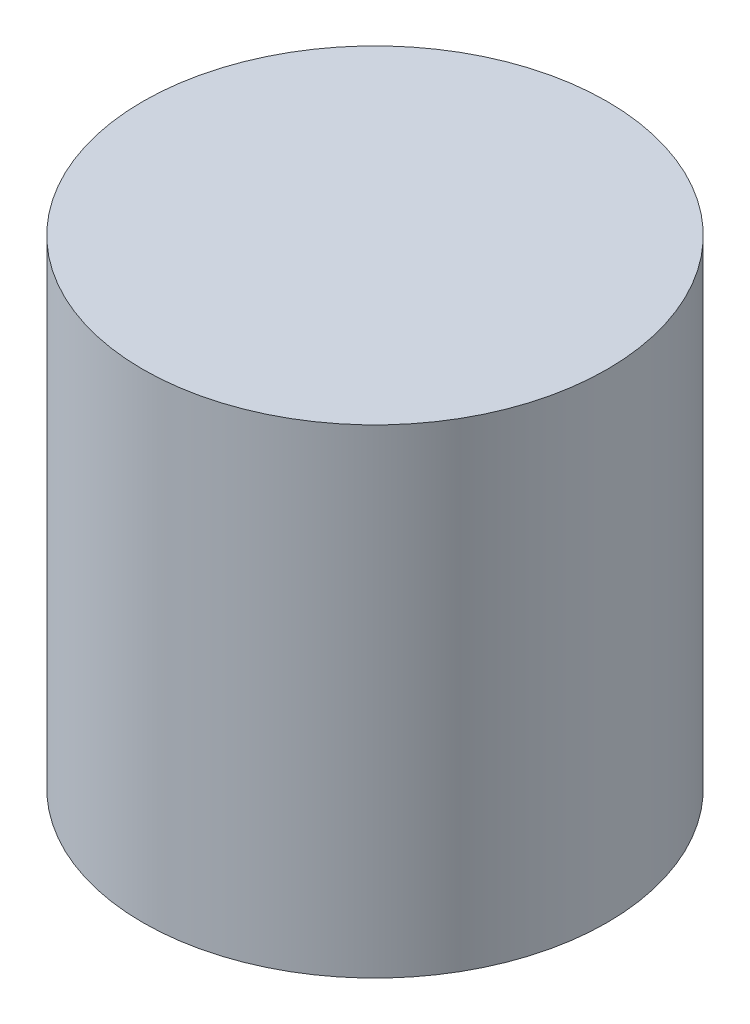
from build123d import *

# Parameters (mm, degrees)
SKETCH_1_R      = 10
EXTRUDE_1_DEPTH = 20.64


with BuildPart() as part:
    # Эскиз1 → Бобышка-Вытянуть1 (new body)
    with BuildSketch(Plane(origin=(0, 0, 0), x_dir=(1, 0, 0), z_dir=(0, 1, 0))):
        Circle(SKETCH_1_R)
    extrude(amount=-EXTRUDE_1_DEPTH)


solid = part.part
